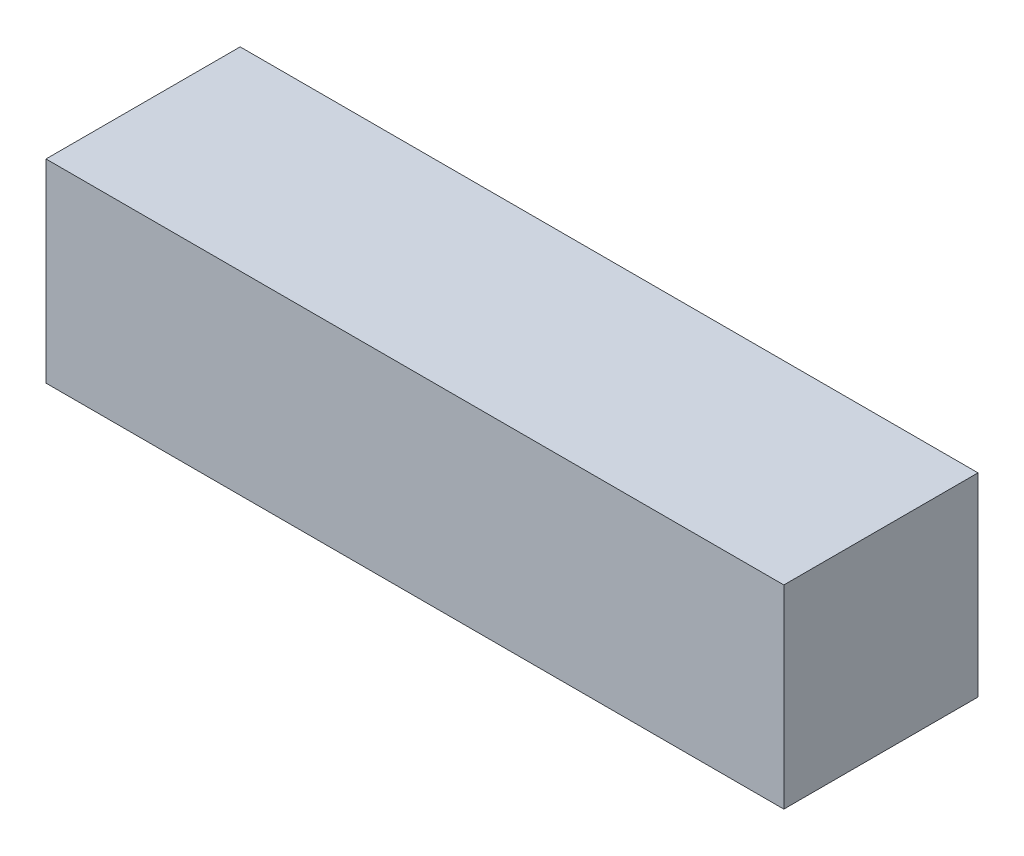
from build123d import *

# Parameters (mm, degrees)
SKETCH1_W           = 152
SKETCH1_H           = 40
BOSS_EXTRUDE1_DEPTH = 40


with BuildPart() as part:
    # Sketch1 → Boss-Extrude1 (new body)
    with BuildSketch(Plane(origin=(0, 0, 0), x_dir=(1, 0, 0), z_dir=(0, 1, 0))):
        with Locations((-76, -20)):
            Rectangle(SKETCH1_W, SKETCH1_H)
    extrude(amount=BOSS_EXTRUDE1_DEPTH)


solid = part.part
